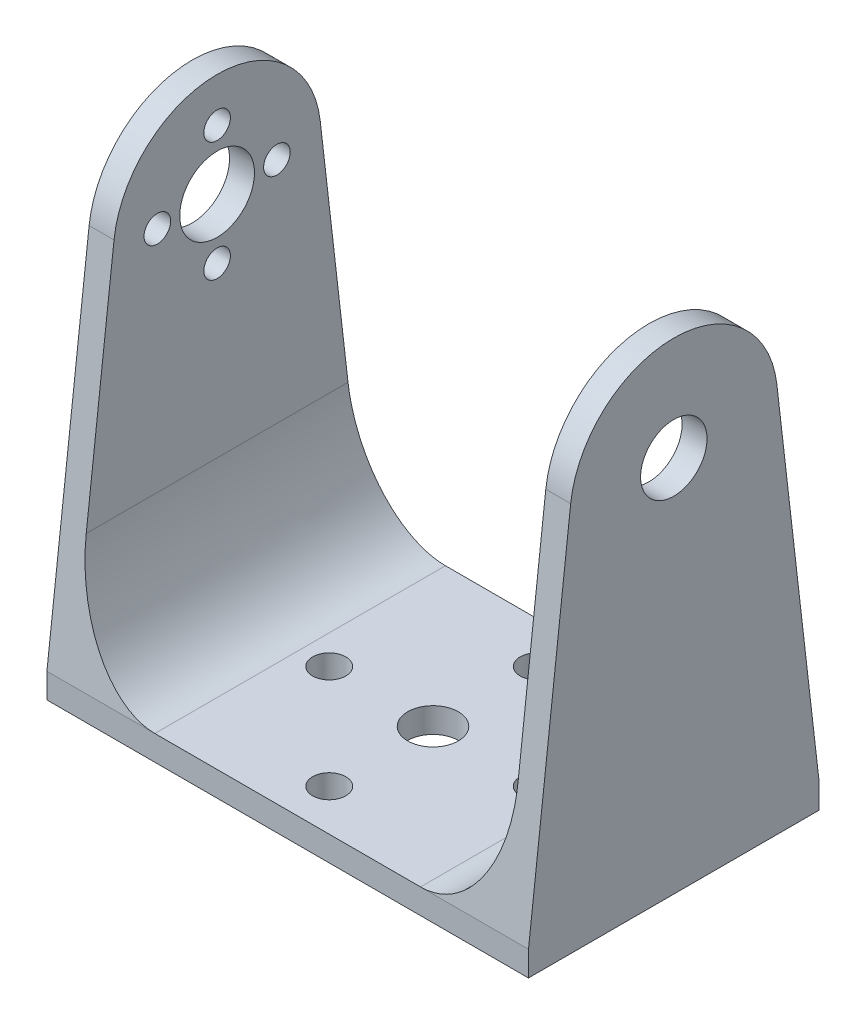
from build123d import *

# Parameters (mm, degrees)
SKETCH1_W           = 58
SKETCH1_H           = 35
BOSS_EXTRUDE1_DEPTH = 1.5
BOSS_EXTRUDE2_DEPTH = 3
SKETCH4_R           = 4.5
SKETCH4_R_2         = 1.6
CUT_EXTRUDE1_DEPTH  = 55
CIRPATTERN1_COUNT   = 4
SKETCH5_R           = 3.05
CUT_EXTRUDE2_DEPTH  = 3
SKETCH6_R           = 2
CUT_EXTRUDE3_DEPTH  = 3
CIRPATTERN2_COUNT   = 4
FILLET1_SIZE        = 10
FILLET1_SIZE_2      = 15
SKETCH8_R           = 4
CUT_EXTRUDE4_DEPTH  = 3


with BuildPart() as part:
    # Sketch1 → Boss-Extrude1 (new, symmetric)
    with BuildSketch(Plane(origin=(0, 0, 0), x_dir=(1, 0, 0), z_dir=(0, 1, 0))):
        Rectangle(SKETCH1_W, SKETCH1_H)
    extrude(amount=BOSS_EXTRUDE1_DEPTH, both=True)

    # Sketch3 → Boss-Extrude2 (add)
    with BuildSketch(Plane.ZY.offset(29)):
        with BuildLine():
            Line((-17.5, 1.5), (-12.417185733, 45.436488243))
            ThreePointArc((-12.417185733, 45.436488243), (0, 56.5), (12.417185733, 45.436488243))
            Line((12.417185733, 45.436488243), (17.5, 1.5))
            Line((17.5, 1.5), (-17.5, 1.5))
        make_face()
    boss_extrude2 = extrude(amount=-BOSS_EXTRUDE2_DEPTH)

    # Sketch4 → Cut-Extrude1 (cut)
    with BuildSketch(Plane.ZY.offset(29)):
        with Locations((0, 44)):
            Circle(SKETCH4_R)
        with Locations((0, 51.2)):
            Circle(SKETCH4_R_2)
    cut_extrude1 = extrude(amount=-CUT_EXTRUDE1_DEPTH, mode=Mode.SUBTRACT)

    # CirPattern1: Cut-Extrude1 ×4 about axis
    cirpattern1_axis = Axis((0, 44, 0), (1, 0, 0))
    for i in range(1, CIRPATTERN1_COUNT):
        add(cut_extrude1.rotate(cirpattern1_axis, i * 360 / CIRPATTERN1_COUNT), mode=Mode.SUBTRACT)

    # Mirror1: Boss-Extrude2 across plane
    add(boss_extrude2.mirror(Plane(origin=(0, 0, 0), x_dir=(0, 0, 1), z_dir=(1, 0, 0))))

    # Sketch5 → Cut-Extrude2 (cut)
    with BuildSketch(Plane(origin=(0, 1.5, 0), x_dir=(1, 0, 0), z_dir=(0, 1, 0))):
        with Locations(Location((0, 0, 0), (0, 0, 270))):
            Circle(SKETCH5_R)
    extrude(amount=-CUT_EXTRUDE2_DEPTH, mode=Mode.SUBTRACT)

    # Sketch6 → Cut-Extrude3 (cut)
    with BuildSketch(Plane(origin=(0, 1.5, 0), x_dir=(1, 0, 0), z_dir=(0, 1, 0))):
        with Locations(Location((0, 12.5, 0), (0, 0, 270))):
            Circle(SKETCH6_R)
    cut_extrude3 = extrude(amount=-CUT_EXTRUDE3_DEPTH, mode=Mode.SUBTRACT)

    # CirPattern2: Cut-Extrude3 ×4 about axis
    cirpattern2_axis = Axis((0, 0, 0), (0, 1, 0))
    for i in range(1, CIRPATTERN2_COUNT):
        add(cut_extrude3.rotate(cirpattern2_axis, i * 360 / CIRPATTERN2_COUNT), mode=Mode.SUBTRACT)

    # Fillet1
    # an asymmetric fillet: 15, 10 mm, written as the material it adds along each edge
    with BuildSketch(Plane(origin=(-26, 1.5, 17.5), x_dir=(1, 0, 0), z_dir=(0, 0, -1))) as fillet1_piece_1_section:
        with BuildLine():
            Bezier((FILLET1_SIZE, 0), (0, 0), (0, -FILLET1_SIZE_2), weights=[1, 0.707106781, 1])
            Line((0, -FILLET1_SIZE_2), (0, 0))
            Line((0, 0), (FILLET1_SIZE, 0))
        make_face()
    fillet1_piece_1 = extrude(amount=35, mode=Mode.PRIVATE)
    fillet1_piece_1 = split(fillet1_piece_1, bisect_by=Plane(origin=(-23.803649904, 6.92315613, -16.872619514), z_dir=(0, -0.11491905943987848, 0.9933748586397049)), keep=Keep.TOP, mode=Mode.PRIVATE)
    fillet1_piece_1 = split(fillet1_piece_1, bisect_by=Plane(origin=(-23.803649904, 6.923154429, 16.872619711), z_dir=(0, -0.1149190594398785, -0.9933748586397049)), keep=Keep.TOP, mode=Mode.PRIVATE)
    add(fillet1_piece_1)
    with BuildSketch(Plane(origin=(26, 1.5, 17.5), x_dir=(-1, 0, 0), z_dir=(0, 0, -1))) as fillet1_piece_2_section:
        with BuildLine():
            Bezier((FILLET1_SIZE, 0), (0, 0), (0, FILLET1_SIZE_2), weights=[1, 0.707106781, 1])
            Line((0, FILLET1_SIZE_2), (0, 0))
            Line((0, 0), (FILLET1_SIZE, 0))
        make_face()
    fillet1_piece_2 = extrude(amount=35, mode=Mode.PRIVATE)
    fillet1_piece_2 = split(fillet1_piece_2, bisect_by=Plane(origin=(23.803649904, 6.92315613, -16.872619514), z_dir=(0, -0.11491905943987848, 0.9933748586397049)), keep=Keep.TOP, mode=Mode.PRIVATE)
    fillet1_piece_2 = split(fillet1_piece_2, bisect_by=Plane(origin=(23.803649904, 6.923154429, 16.872619711), z_dir=(0, -0.1149190594398785, -0.9933748586397049)), keep=Keep.TOP, mode=Mode.PRIVATE)
    add(fillet1_piece_2)

    # Sketch8 → Cut-Extrude4 (cut)
    with BuildSketch(Plane(origin=(29, 0, 0), x_dir=(0, 0, -1), z_dir=(1, 0, 0))):
        with Locations((0, 44)):
            Circle(SKETCH8_R)
    extrude(amount=-CUT_EXTRUDE4_DEPTH, mode=Mode.SUBTRACT)


solid = part.part
